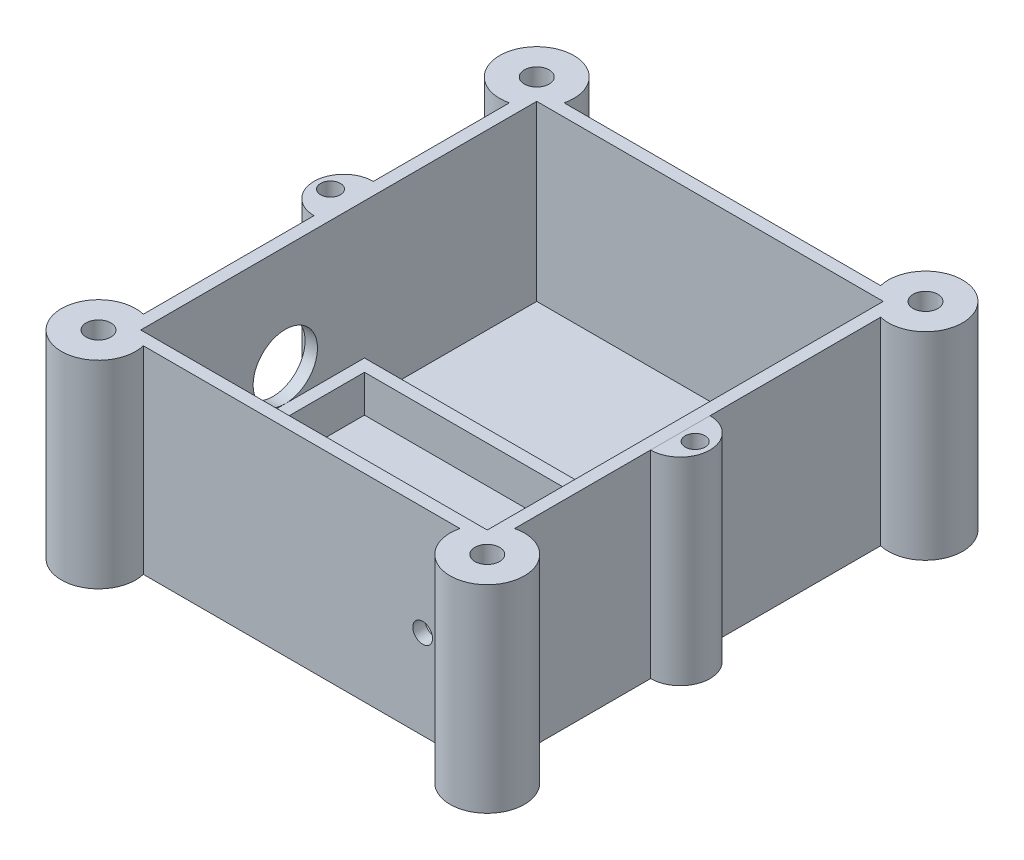
from build123d import *

# Parameters (mm, degrees)
SKETCH1_R           = 3.175
BOSS_EXTRUDE1_DEPTH = 6.35
SKETCH1_3_R         = 3.175
SKETCH1_3_W         = 88.9
SKETCH1_3_H         = 101.6
BOSS_EXTRUDE2_DEPTH = 50.8
SKETCH3_R           = 2.54
CUT_EXTRUDE1_DEPTH  = 12.7
SKETCH5_W           = 7.62
SKETCH5_H           = 50.8
REVOLVE1_ANGLE      = 180
SKETCH6_W           = 7.62
SKETCH6_H           = 50.8
REVOLVE2_ANGLE      = 180
SKETCH7_R           = 2.54
CUT_EXTRUDE2_DEPTH  = 169.424546419
SKETCH9_R           = 2.54
CUT_EXTRUDE3_DEPTH  = 169.424546419
SKETCH10_W          = 88.9
SKETCH10_H          = 57.404
SKETCH10_W_2        = 81.534
SKETCH10_H_2        = 51.054
BOSS_EXTRUDE3_DEPTH = 9.525
SKETCH11_W          = 50.8
SKETCH11_H          = 3.175
BOSS_EXTRUDE4_DEPTH = 5.08
SKETCH12_R          = 8.255
CUT_EXTRUDE4_DEPTH  = 7.62
FILLET1_R           = 3.175


with BuildPart() as part:
    # Sketch1 → Boss-Extrude1 (new body)
    with BuildSketch(Plane(origin=(0, 0, 0), x_dir=(1, 0, 0), z_dir=(0, 1, 0))):
        with BuildLine():
            Line((-7.011572103, 0), (-88.238427897, 0))
            ThreePointArc((-88.238427897, 0), (-104.230256121, 8.980256121), (-95.25, -7.011572103))
            Line((-95.25, -7.011572103), (-95.25, -100.938427897))
            ThreePointArc((-95.25, -100.938427897), (-104.230256121, -116.930256121), (-88.238427897, -107.95))
            Line((-88.238427897, -107.95), (-7.011572103, -107.95))
            ThreePointArc((-7.011572103, -107.95), (8.980256121, -116.930256121), (0, -100.938427897))
            Line((0, -100.938427897), (0, -7.011572103))
            ThreePointArc((0, -7.011572103), (8.980256121, 8.980256121), (-7.011572103, 0))
        make_face()
        with Locations((-97.49506403, 2.24506403)):
            Circle(SKETCH1_R, mode=Mode.SUBTRACT)
        with Locations((2.24506403, 2.24506403)):
            Circle(SKETCH1_R, mode=Mode.SUBTRACT)
        with Locations((2.24506403, -110.19506403)):
            Circle(SKETCH1_R, mode=Mode.SUBTRACT)
        with Locations((-97.49506403, -110.19506403)):
            Circle(SKETCH1_R, mode=Mode.SUBTRACT)
    extrude(amount=BOSS_EXTRUDE1_DEPTH)

    # Sketch1<3> → Boss-Extrude2 (add)
    with BuildSketch(Plane(origin=(0, 0, 0), x_dir=(1, 0, 0), z_dir=(0, 1, 0))):
        with BuildLine():
            Line((-7.011572103, 0), (-88.238427897, 0))
            ThreePointArc((-88.238427897, 0), (-104.230256121, 8.980256121), (-95.25, -7.011572103))
            Line((-95.25, -7.011572103), (-95.25, -100.938427897))
            ThreePointArc((-95.25, -100.938427897), (-104.230256121, -116.930256121), (-88.238427897, -107.95))
            Line((-88.238427897, -107.95), (-7.011572103, -107.95))
            ThreePointArc((-7.011572103, -107.95), (8.980256121, -116.930256121), (0, -100.938427897))
            Line((0, -100.938427897), (0, -7.011572103))
            ThreePointArc((0, -7.011572103), (8.980256121, 8.980256121), (-7.011572103, 0))
        make_face()
        with Locations((-97.49506403, 2.24506403)):
            Circle(SKETCH1_3_R, mode=Mode.SUBTRACT)
        with Locations((2.24506403, 2.24506403)):
            Circle(SKETCH1_3_R, mode=Mode.SUBTRACT)
        with Locations((2.24506403, -110.19506403)):
            Circle(SKETCH1_3_R, mode=Mode.SUBTRACT)
        with Locations((-97.49506403, -110.19506403)):
            Circle(SKETCH1_3_R, mode=Mode.SUBTRACT)
        with Locations((-47.625, -53.975)):
            Rectangle(SKETCH1_3_W, SKETCH1_3_H, mode=Mode.SUBTRACT)
    extrude(amount=BOSS_EXTRUDE2_DEPTH)

    # Sketch3 → Cut-Extrude1 (cut)
    with BuildSketch(Plane.XY.offset(107.95)):
        with Locations((-16.566148484, 22.86)):
            Circle(SKETCH3_R)
    extrude(amount=-CUT_EXTRUDE1_DEPTH, mode=Mode.SUBTRACT)

    # Sketch6 → Revolve2 (revolve)
    with BuildSketch(Plane.ZY.offset(95.25)):
        with Locations((53.34, 25.4)):
            Rectangle(SKETCH6_W, SKETCH6_H)
    revolve(axis=Axis((-95.25, 50.8, 49.53), (0, -1, 0)), revolution_arc=REVOLVE2_ANGLE)

    # Sketch7 → Cut-Extrude2 (cut, through all)
    with BuildSketch(Plane(origin=(0, 50.8, 0), x_dir=(1, 0, 0), z_dir=(0, 1, 0))):
        with Locations((-99.038975602, -49.13029525)):
            Circle(SKETCH7_R)
    extrude(amount=-CUT_EXTRUDE2_DEPTH, mode=Mode.SUBTRACT)

    # Sketch10 → Boss-Extrude3 (add)
    with BuildSketch(Plane(origin=(0, 6.35, 0), x_dir=(1, 0, 0), z_dir=(0, 1, 0))):
        with Locations((-47.625, -76.073)):
            Rectangle(SKETCH10_W, SKETCH10_H)
        with Locations((-48.133, -76.073)):
            Rectangle(SKETCH10_W_2, SKETCH10_H_2, mode=Mode.SUBTRACT)
    extrude(amount=BOSS_EXTRUDE3_DEPTH)

    # Sketch11 → Boss-Extrude4 (add)
    with BuildSketch(Plane(origin=(0, 6.35, 0), x_dir=(1, 0, 0), z_dir=(0, 1, 0))):
        with Locations((-48.133, -76.073)):
            Rectangle(SKETCH11_W, SKETCH11_H)
    extrude(amount=BOSS_EXTRUDE4_DEPTH)

    # Sketch12 → Cut-Extrude4 (cut)
    with BuildSketch(Plane.ZY.offset(95.25)):
        with Locations((67.691, 24.13)):
            Circle(SKETCH12_R)
    extrude(amount=-CUT_EXTRUDE4_DEPTH, mode=Mode.SUBTRACT)

    # Fillet1
    fillet1_edges = [part.edges().sort_by_distance(p)[0] for p in [
        (-100.67006403, 0, 110.19506403),
        (-0.92993597, 0, 110.19506403),
        (-100.67006403, 0, -2.24506403),
        (-0.92993597, 0, -2.24506403),
    ]]
    fillet(fillet1_edges, radius=FILLET1_R)


with BuildPart() as body_2:
    # Sketch5 → Revolve1 (revolve)
    with BuildSketch(Plane(origin=(0, 0, 0), x_dir=(0, 0, -1), z_dir=(1, 0, 0))):
        with Locations((-62.23, 25.4)):
            Rectangle(SKETCH5_W, SKETCH5_H)
    revolve(axis=Axis((0, 50.8, 58.42), (0, 1, 0)), revolution_arc=REVOLVE1_ANGLE)

    # Sketch9 → Cut-Extrude3 (cut, through all)
    with BuildSketch(Plane(origin=(0, 50.8, 0), x_dir=(1, 0, 0), z_dir=(0, 1, 0))):
        with Locations((3.81, -58.42)):
            Circle(SKETCH9_R)
    extrude(amount=-CUT_EXTRUDE3_DEPTH, mode=Mode.SUBTRACT)


solid = Compound([part.part, body_2.part])
